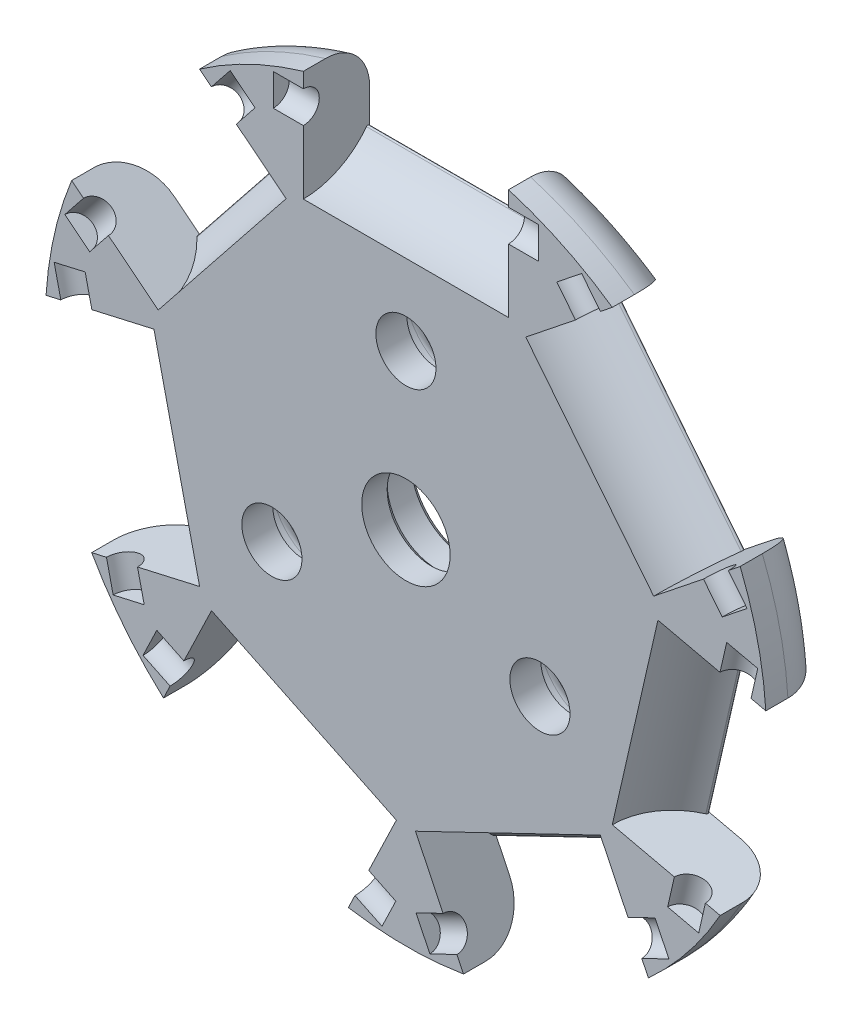
from build123d import *

# Parameters (mm, degrees)
SKETCH1_R                = 25.8953
BOSS_EXTRUDE2_DEPTH      = 4.7625
FILLET1_R                = 3.175
SKETCH2_W                = 14.732
SKETCH2_H                = 10.414
CUT_EXTRUDE2_DEPTH       = 12.7
CIRPATTERN1_COUNT        = 7
SKETCH4_R                = 1.143
CUT_EXTRUDE4_DEPTH       = 9.525
CIRPATTERN2_COUNT        = 7
SKETCH5_R                = 3.175
CUT_EXTRUDE5_DEPTH       = 37.89266219
SKETCH6_R                = 2.159
CUT_EXTRUDE7_DEPTH       = 37.89266219
SKETCH7_R                = 4.064
CUT_EXTRUDE8_DEPTH       = 2.54
BOSS_EXTRUDE4_REACH      = 44.38
FILLET2_R                = 0.127
CIRPATTERN5_COUNT        = 7
FILLET2_OF_CIRPATTERN5_R = 0.127
SKETCH11_R               = 4.0005
CUT_EXTRUDE9_DEPTH       = 2.54
CHAMFER1_SIZE            = 0.396875
FILLET3_R                = 0.79375


with BuildPart() as part:
    # Sketch1 → Boss-Extrude2 (new body)
    with BuildSketch(Plane.XY):
        Circle(SKETCH1_R)
    extrude(amount=-BOSS_EXTRUDE2_DEPTH)

    # Fillet1
    fillet1_edges = [part.edges().sort_by_distance(p)[0] for p in [
        (-25.8953, 0, -4.7625),
    ]]
    fillet(fillet1_edges, radius=FILLET1_R)

    # Sketch2 → Cut-Extrude2 (cut)
    with BuildSketch(Plane.XY):
        with Locations((0, 21.9583)):
            Rectangle(SKETCH2_W, SKETCH2_H)
    cut_extrude2 = extrude(amount=-CUT_EXTRUDE2_DEPTH, mode=Mode.SUBTRACT)

    # CirPattern1: Cut-Extrude2 ×7 about axis
    cirpattern1_axis = Axis((0, 0, 0), (0, 0, 1))
    for i in range(1, CIRPATTERN1_COUNT):
        add(cut_extrude2.rotate(cirpattern1_axis, i * 360 / CIRPATTERN1_COUNT), mode=Mode.SUBTRACT)

    # Sketch4 → Cut-Extrude4 (cut, symmetric)
    with BuildSketch(Plane(origin=(0, 0, 0), x_dir=(0, 0, -1), z_dir=(1, 0, 0))):
        with Locations((0, 22.5933)):
            Circle(SKETCH4_R)
    cut_extrude4 = extrude(amount=CUT_EXTRUDE4_DEPTH, both=True, mode=Mode.SUBTRACT)

    # CirPattern2: Cut-Extrude4 ×7 about axis
    cirpattern2_axis = Axis((0, 0, 0), (0, 0, 1))
    for i in range(1, CIRPATTERN2_COUNT):
        add(cut_extrude4.rotate(cirpattern2_axis, i * 360 / CIRPATTERN2_COUNT), mode=Mode.SUBTRACT)

    # Sketch5 → Cut-Extrude5 (cut, through all)
    with BuildSketch(Plane.XY):
        Circle(SKETCH5_R)
    extrude(amount=-CUT_EXTRUDE5_DEPTH, mode=Mode.SUBTRACT)

    # Sketch6 → Cut-Extrude7 (cut, through all)
    with BuildSketch(Plane(origin=(0, 0, -4.7625), x_dir=(-1, 0, 0), z_dir=(0, 0, -1))):
        with Locations((0, 11.1125)):
            Circle(SKETCH6_R)
        with Locations((9.6237073, -5.55625)):
            Circle(SKETCH6_R)
        with Locations((-9.6237073, -5.55625)):
            Circle(SKETCH6_R)
    extrude(amount=-CUT_EXTRUDE7_DEPTH, mode=Mode.SUBTRACT)

    # Sketch7 → Cut-Extrude8 (cut)
    with BuildSketch(Plane(origin=(0, 0, -4.7625), x_dir=(-1, 0, 0), z_dir=(0, 0, -1))):
        with Locations((-9.6237073, -5.55625)):
            Circle(SKETCH7_R)
        with Locations((0, 11.1125)):
            Circle(SKETCH7_R)
        with Locations((9.6237073, -5.55625)):
            Circle(SKETCH7_R)
    extrude(amount=-CUT_EXTRUDE8_DEPTH, mode=Mode.SUBTRACT)

    # Sketch10 → Boss-Extrude4 (add, up to next)
    with BuildSketch(Plane.ZY.offset(-7.366), mode=Mode.PRIVATE) as boss_extrude4_sk1:
        with BuildLine():
            Line((-4.7625, 16.7513), (0, 16.7513))
            Line((0, 16.7513), (0, 16.8783))
            ThreePointArc((0, 16.8783), (-2.7025038, 17.55765722), (-4.7625, 19.434214887))
            Line((-4.7625, 19.434214887), (-4.7625, 16.7513))
        make_face()
    boss_extrude4_tool1 = extrude(boss_extrude4_sk1.sketch, amount=BOSS_EXTRUDE4_REACH, mode=Mode.PRIVATE) - part.part
    boss_extrude4 = boss_extrude4_tool1.solids().sort_by_distance((7.366, 17.489807, -3.452063))[0]
    add(boss_extrude4)

    # Fillet2
    fillet2_edges = [part.edges().sort_by_distance(p)[0] for p in [
        (0, 19.434214887, -4.7625),
    ]]
    fillet(fillet2_edges, radius=FILLET2_R)

    # CirPattern5: Boss-Extrude4 ×7 about axis
    cirpattern5_axis = Axis((0, 0, 0), (0, 0, 1))
    for i in range(1, CIRPATTERN5_COUNT):
        add(boss_extrude4.rotate(cirpattern5_axis, i * 360 / CIRPATTERN5_COUNT))

    # Fillet2 of CirPattern5
    fillet2_of_cirpattern5_edges = [part.edges().sort_by_distance(p)[0] for p in [
        (-15.194281036, 12.117034789, -4.7625),
        (-18.946958545, -4.324519647, -4.7625),
        (-8.432189822, -17.509622585, -4.7625),
        (8.432189822, -17.509622585, -4.7625),
        (18.946958545, -4.324519647, -4.7625),
        (15.194281036, 12.117034789, -4.7625),
    ]]
    fillet(fillet2_of_cirpattern5_edges, radius=FILLET2_OF_CIRPATTERN5_R)

    # Sketch11 → Cut-Extrude9 (cut)
    with BuildSketch(Plane(origin=(0, 0, -4.7625), x_dir=(-1, 0, 0), z_dir=(0, 0, -1))):
        Circle(SKETCH11_R)
    extrude(amount=-CUT_EXTRUDE9_DEPTH, mode=Mode.SUBTRACT)

    # Chamfer1
    chamfer1_edges = [part.edges().sort_by_distance(p)[0] for p in [
        (4.0005, 0, -4.7625),
        (-3.175, 0, -2.2225),
    ]]
    chamfer(chamfer1_edges, length=CHAMFER1_SIZE)

    # Fillet3
    fillet3_edges = [part.edges().sort_by_distance(p)[0] for p in [
        (-5.5597073, -5.55625, -4.7625),
        (13.6877073, -5.55625, -4.7625),
        (4.064, 11.1125, -4.7625),
    ]]
    fillet(fillet3_edges, radius=FILLET3_R)


solid = part.part
